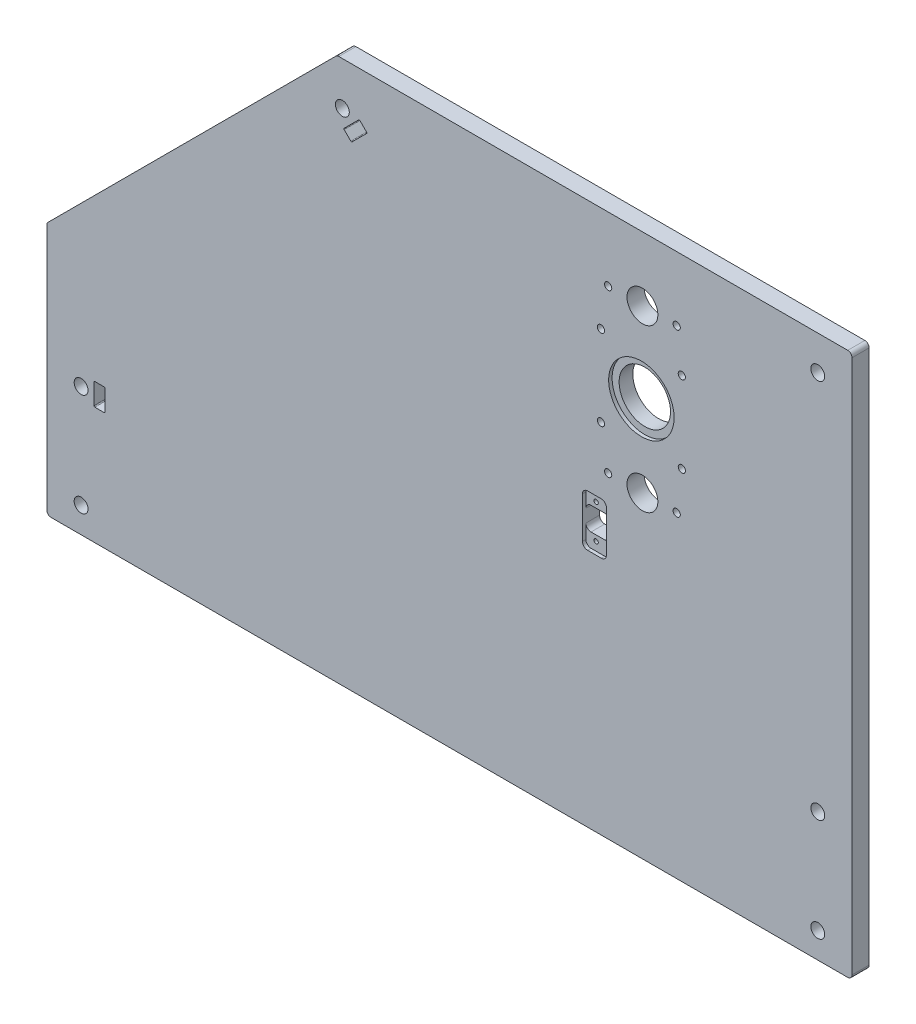
from build123d import *

# Parameters (mm, degrees)
SKETCH2_W             = 470
SKETCH2_H             = 317
BOSS_EXTRUDE1_DEPTH   = 5
SKETCH3_R             = 4.05
CUT_EXTRUDE1_DEPTH    = 10
SKETCH4_R             = 9
CUT_EXTRUDE2_DEPTH    = 284.632244288
M5X0_8_TAPPED_HOLE1_D = 4.2
SKETCH7_R             = 19.1
CUT_EXTRUDE5_DEPTH    = 2
M5X0_8_TAPPED_HOLE2_D = 4.2
SKETCH19_R            = 15
CUT_EXTRUDE10_DEPTH   = 284.568774727
SKETCH20_W            = 14
SKETCH20_H            = 30
CUT_EXTRUDE11_DEPTH   = 2
M3X0_5_TAPPED_HOLE2_D = 2.5
SKETCH23_W            = 14
SKETCH23_H            = 13.5
CUT_EXTRUDE13_DEPTH   = 284.568774727
FILLET1_R             = 3
FILLET2_R             = 2.5
CUT_EXTRUDE14_DEPTH   = 284.632244288
FILLET3_R             = 2.5
SKETCH27_R            = 4.05
CUT_EXTRUDE15_DEPTH   = 284.632244288
CUT_EXTRUDE16_DEPTH   = 284.632244288
CUT_EXTRUDE17_DEPTH   = 284.632244288


with BuildPart() as part:
    # Sketch2 → Boss-Extrude1 (new, symmetric)
    with BuildSketch(Plane.XY):
        Rectangle(SKETCH2_W, SKETCH2_H)
    extrude(amount=BOSS_EXTRUDE1_DEPTH, both=True)

    # Sketch3 → Cut-Extrude1 (cut)
    with BuildSketch(Plane.XY.offset(5)):
        with Locations((-215, -83.5)):
            Circle(SKETCH3_R)
        with Locations((-215, -143.5)):
            Circle(SKETCH3_R)
        with Locations((215, -143.5)):
            Circle(SKETCH3_R)
        with Locations((-62.5, 133.34)):
            Circle(SKETCH3_R)
        with Locations((215, 138.5)):
            Circle(SKETCH3_R)
    extrude(amount=-CUT_EXTRUDE1_DEPTH, mode=Mode.SUBTRACT)

    # Sketch4 → Cut-Extrude2 (cut, through all)
    with BuildSketch(Plane.XY.offset(5)):
        with Locations((112.65, 121)):
            Circle(SKETCH4_R)
        with Locations((112.65, 26.5)):
            Circle(SKETCH4_R)
    extrude(amount=-CUT_EXTRUDE2_DEPTH, mode=Mode.SUBTRACT)

    # M5x0.8 Tapped Hole1 (through all)
    with Locations(Plane.XY.offset(5)):
        with Locations((132.65, 121), (92.65, 121), (92.65, 26.5), (132.65, 26.5)):
            Hole(M5X0_8_TAPPED_HOLE1_D / 2)

    # Sketch7 → Cut-Extrude5 (cut)
    with BuildSketch(Plane.XY.offset(5)):
        with Locations((112.05, 73.75)):
            Circle(SKETCH7_R)
    extrude(amount=-CUT_EXTRUDE5_DEPTH, mode=Mode.SUBTRACT)

    # M5x0.8 Tapped Hole2 (through all)
    with Locations(Plane.XY.offset(5)):
        with Locations((88.45, 97.35), (135.65, 97.35), (135.65, 50.15), (88.45, 50.15)):
            Hole(M5X0_8_TAPPED_HOLE2_D / 2)

    # Sketch19 → Cut-Extrude10 (cut, through all)
    with BuildSketch(Plane.XY.offset(3)):
        with Locations((112.05, 73.75)):
            Circle(SKETCH19_R)
    extrude(amount=-CUT_EXTRUDE10_DEPTH, mode=Mode.SUBTRACT)

    # Sketch20 → Cut-Extrude11 (cut)
    with BuildSketch(Plane.XY.offset(5)):
        with Locations((84.65, -3.5)):
            Rectangle(SKETCH20_W, SKETCH20_H)
    extrude(amount=-CUT_EXTRUDE11_DEPTH, mode=Mode.SUBTRACT)

    # M3x0.5 Tapped Hole2 (through all)
    with Locations(Plane.XY.offset(3)):
        with Locations((83.65, 6.5), (83.65, -13.5)):
            Hole(M3X0_5_TAPPED_HOLE2_D / 2)

    # Sketch23 → Cut-Extrude13 (cut, through all)
    with BuildSketch(Plane.XY.offset(3)):
        with Locations((84.65, -3.5)):
            Rectangle(SKETCH23_W, SKETCH23_H)
    extrude(amount=-CUT_EXTRUDE13_DEPTH, mode=Mode.SUBTRACT)

    # Fillet1
    fillet1_edges = [part.edges().sort_by_distance(p)[0] for p in [
        (91.65, -18.5, 4),
        (77.65, -18.5, 4),
        (77.65, 11.5, 4),
        (91.65, 11.5, 4),
        (77.65, -10.25, -1),
        (77.65, 3.25, -1),
        (91.65, 3.25, -1),
        (91.65, -10.25, -1),
    ]]
    fillet(fillet1_edges, radius=FILLET1_R)

    # Fillet2
    fillet2_edges = [part.edges().sort_by_distance(p)[0] for p in [
        (-235, -158.5, 0),
        (235, -158.5, 0),
        (235, 158.5, 0),
        (-235, 158.5, 0),
    ]]
    fillet(fillet2_edges, radius=FILLET2_R)

    # Sketch26 → Cut-Extrude14 (cut, through all)
    with BuildSketch(Plane.XY.offset(5)):
        Polygon((-32.351626406, 191.772644842), (-286.046542749, -61.922271502), (-286.046542749, 282.491923936), align=None)
    extrude(amount=-CUT_EXTRUDE14_DEPTH, mode=Mode.SUBTRACT)

    # Fillet3
    fillet3_edges = [part.edges().sort_by_distance(p)[0] for p in [
        (-235, -10.875728753, 0),
        (-65.624271247, 158.5, 0),
    ]]
    fillet(fillet3_edges, radius=FILLET3_R)

    # Sketch27 → Cut-Extrude15 (cut, through all)
    with BuildSketch(Plane.XY.offset(5)):
        with Locations((215, -83.5)):
            Circle(SKETCH27_R)
    extrude(amount=-CUT_EXTRUDE15_DEPTH, mode=Mode.SUBTRACT)

    # Sketch28 → Cut-Extrude16 (cut, through all)
    with BuildSketch(Plane.XY.offset(5)):
        with BuildLine():
            Line((-61.439339828, 123.086951673), (-57.550252532, 119.197864376))
            ThreePointArc((-57.550252532, 119.197864376), (-57.196699141, 119.051417767), (-56.843145751, 119.197864376))
            Line((-56.843145751, 119.197864376), (-48.357864376, 127.683145751))
            ThreePointArc((-48.357864376, 127.683145751), (-48.211417767, 128.036699141), (-48.357864376, 128.390252532))
            Line((-48.357864376, 128.390252532), (-52.246951673, 132.279339828))
            ThreePointArc((-52.246951673, 132.279339828), (-52.600505063, 132.425786438), (-52.954058454, 132.279339828))
            Line((-52.954058454, 132.279339828), (-61.439339828, 123.794058454))
            ThreePointArc((-61.439339828, 123.794058454), (-61.585786438, 123.440505063), (-61.439339828, 123.086951673))
        make_face()
    extrude(amount=-CUT_EXTRUDE16_DEPTH, mode=Mode.SUBTRACT)

    # Sketch29 → Cut-Extrude17 (cut, through all)
    with BuildSketch(Plane.XY.offset(5)):
        with BuildLine():
            Line((-207, -90), (-201.5, -90))
            ThreePointArc((-201.5, -90), (-201.146446609, -89.853553391), (-201, -89.5))
            Line((-201, -89.5), (-201, -77.5))
            ThreePointArc((-201, -77.5), (-201.146446609, -77.146446609), (-201.5, -77))
            Line((-201.5, -77), (-207, -77))
            ThreePointArc((-207, -77), (-207.353553391, -77.146446609), (-207.5, -77.5))
            Line((-207.5, -77.5), (-207.5, -89.5))
            ThreePointArc((-207.5, -89.5), (-207.353553391, -89.853553391), (-207, -90))
        make_face()
    extrude(amount=-CUT_EXTRUDE17_DEPTH, mode=Mode.SUBTRACT)


solid = part.part
